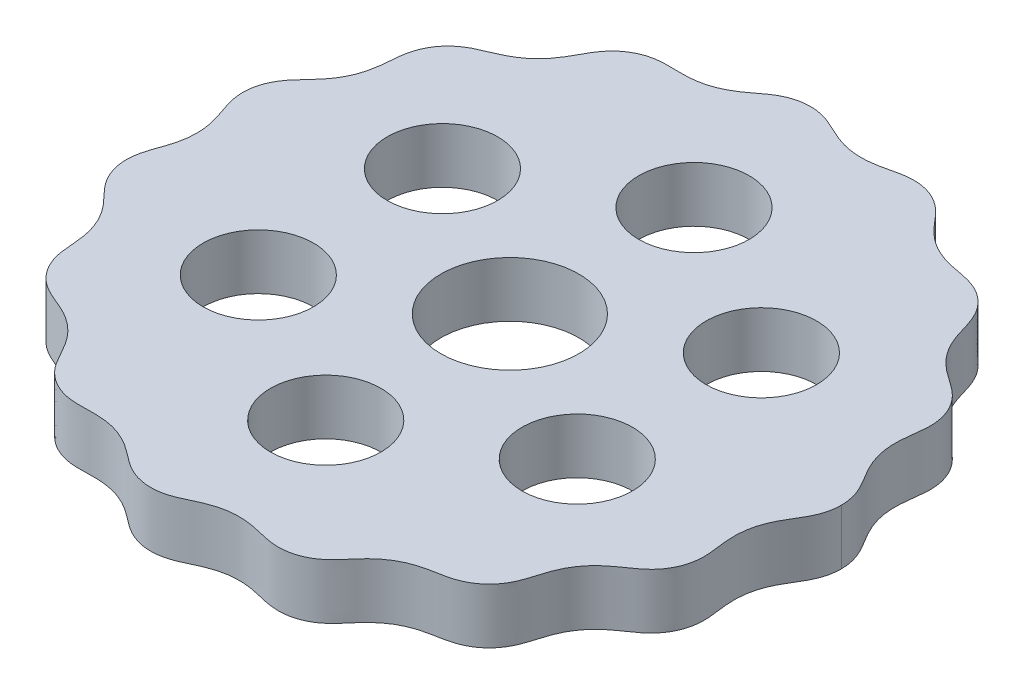
from build123d import *

# Parameters (mm, degrees)
BOSS_EXTRUDE1_DEPTH = 6
SKETCH4_R           = 7.5
SKETCH4_R_2         = 6
CUT_EXTRUDE1_DEPTH  = 52.384193919


with BuildPart() as part:
    # Sketch3 → Boss-Extrude1 (new body)
    with BuildSketch(Plane(origin=(0, 0, 0), x_dir=(1, 0, 0), z_dir=(0, 1, 0))):
        with BuildLine():
            add(Edge.make_bspline(
                [(-35, 0), (-35, -0.035819522), (-35.000616373, -0.107462841), (-35.003390054, -0.256808001), (-35.01077535, -0.421646413), (-35.021825769, -0.588219856), (-35.036504882, -0.756672424), (-35.059341773, -0.965837166), (-35.104035951, -1.290553755), (-35.185204177, -1.728353622), (-35.321111932, -2.274340703), (-35.511398877, -2.882930915), (-35.744117036, -3.541888991), (-35.999231193, -4.25800942), (-36.256031973, -5.161379022), (-36.390330129, -6.274752326), (-36.277015947, -7.512136969), (-35.868698722, -8.695231313), (-35.277300884, -9.669426211), (-34.554347705, -10.519941998), (-33.783626013, -11.298902855), (-32.985846748, -12.201646947), (-32.264584631, -13.30297659), (-31.737724515, -14.528623762), (-31.426244596, -15.845428611), (-31.299137645, -17.27258243), (-31.216127, -18.70530298), (-30.816120234, -20.100603953), (-30.073240875, -21.341751418), (-29.174351138, -22.250438515), (-28.172415899, -22.896093055), (-27.127590318, -23.355931746), (-26.10859664, -23.758738206), (-25.049780962, -24.277964858), (-23.989709649, -24.997868072), (-23.038745697, -25.922173331), (-22.234852767, -27.03288543), (-21.57001817, -28.281907032), (-20.900127092, -29.513378936), (-19.962466181, -30.574068753), (-18.795181919, -31.366318649), (-17.595631263, -31.810691732), (-16.414666993, -31.974330851), (-15.281171148, -31.958959306), (-14.203514384, -31.91747762), (-13.042151806, -31.968001953), (-11.783279681, -32.201214224), (-10.531309832, -32.66971044), (-9.48395263, -33.292502605), (-8.648334169, -33.920550223), (-7.823957174, -34.560196788), (-6.963270269, -35.155080008), (-5.844676613, -35.655024643), (-4.471519425, -35.893755086), (-3.187084678, -35.805499477), (-2.025952576, -35.461710054), (-0.992256939, -34.976213141), (-0.022683462, -34.502923006), (1.053080375, -34.087641485), (2.299584809, -33.794526859), (3.643320491, -33.722351619), (5.038534255, -33.89893647), (6.24598376, -34.2125404), (7.264354515, -34.444119372), (8.305207807, -34.543324073), (9.35208771, -34.482213909), (10.516758731, -34.167289325), (11.659268337, -33.537177777), (12.590715473, -32.709121516), (13.34098787, -31.814858509), (14.054283468, -30.982389039), (14.885038409, -30.182951686), (15.921872801, -29.431794231), (16.990420846, -28.917750141), (18.026343297, -28.602305782), (18.918007091, -28.413618025), (19.578784746, -28.293993849), (20.403759493, -28.135463838), (21.377672688, -27.861653344), (22.443971731, -27.335099919), (23.483734656, -26.460176512), (24.2541157, -25.405895772), (24.750574375, -24.262578026), (25.063904971, -23.146552345), (25.378639074, -22.114017621), (25.813131886, -21.064921211), (26.460434486, -19.960662125), (27.343829971, -18.932625358), (28.322904319, -18.143559056), (29.218225657, -17.541804862), (30.028748291, -16.97273782), (30.797058719, -16.328598531), (31.549909645, -15.413617977), (32.137977425, -14.188738612), (32.4089126, -12.90202686), (32.388985538, -11.637704019), (32.213594686, -10.474436855), (32.085323796, -9.385180269), (32.070146733, -8.410557002), (32.151917663, -7.56387468), (32.314560623, -6.756019588), (32.548800101, -5.992599911), (32.857935391, -5.266485518), (33.224571124, -4.579437291), (33.588738685, -3.973485748), (33.923596212, -3.433268023), (34.247631958, -2.87530324), (34.535248612, -2.28660009), (34.721954293, -1.781365153), (34.833464319, -1.375289499), (34.894669525, -1.087159539), (34.924762046, -0.921603412), (34.949915122, -0.755248907), (34.967564963, -0.608302523), (34.979558938, -0.483828007), (34.987456793, -0.380154151), (34.992514334, -0.294893351), (34.997257891, -0.183172559), (34.999367206, -0.089514524), (35, -0.035799586), (35, 0)],
                knots=[0.072369566, 0.072369566, 0.072369566, 0.072369566, 0.072369566, 0.073615092, 0.074860618, 0.076106145, 0.077351671, 0.078597197, 0.079842723, 0.082333775, 0.087048504, 0.091763233, 0.096477961, 0.10119269, 0.107724794, 0.114256899, 0.124215283, 0.134174364, 0.144132897, 0.150929746, 0.157726596, 0.167142542, 0.176558488, 0.186520945, 0.196481925, 0.206428247, 0.21637457, 0.228908069, 0.238866866, 0.248825964, 0.258784129, 0.266347185, 0.273910241, 0.282559119, 0.291207998, 0.301173216, 0.311644672, 0.321600071, 0.33155547, 0.343058906, 0.353017844, 0.362977018, 0.372934936, 0.380512964, 0.388090993, 0.396475019, 0.404859045, 0.41482336, 0.425823506, 0.435780105, 0.440758404, 0.445736704, 0.456709828, 0.4666684, 0.476627191, 0.48658549, 0.494428383, 0.502271277, 0.510390705, 0.518510134, 0.528474739, 0.540002591, 0.549960093, 0.559917595, 0.565389224, 0.570860853, 0.580819423, 0.590778216, 0.600736338, 0.609094586, 0.617452834, 0.625307542, 0.633162249, 0.643125841, 0.655188139, 0.660154677, 0.665121215, 0.670087753, 0.675054292, 0.685012018, 0.694970449, 0.704929277, 0.714887192, 0.723259667, 0.731632143, 0.739222078, 0.746812013, 0.756777196, 0.769365725, 0.779035556, 0.783870472, 0.788705388, 0.798661668, 0.808620831, 0.818580086, 0.828537566, 0.837174689, 0.845811813, 0.853388632, 0.860965452, 0.865947313, 0.870929173, 0.87773944, 0.884549706, 0.889251298, 0.893952891, 0.898654484, 0.903356076, 0.908334949, 0.913313821, 0.914558654, 0.915803487, 0.91704832, 0.918293153, 0.919537985, 0.920160402, 0.920782818, 0.921405235, 0.922027651, 0.923272484, 0.923272484, 0.923272484, 0.923272484, 0.923272484], degree=4))
            add(Edge.make_bspline(
                [(-35, 0), (-35, 0.035819522), (-35.000616373, 0.107462841), (-35.003390054, 0.256808001), (-35.01077535, 0.421646413), (-35.021825769, 0.588219856), (-35.036504882, 0.756672424), (-35.059341773, 0.965837166), (-35.104035951, 1.290553755), (-35.185204177, 1.728353622), (-35.321111932, 2.274340703), (-35.511398877, 2.882930915), (-35.744117036, 3.541888991), (-35.999231193, 4.25800942), (-36.256031973, 5.161379022), (-36.390330129, 6.274752326), (-36.277015947, 7.512136969), (-35.868698722, 8.695231313), (-35.277300884, 9.669426211), (-34.554347705, 10.519941998), (-33.783626013, 11.298902855), (-32.985846748, 12.201646947), (-32.264584631, 13.30297659), (-31.737724515, 14.528623762), (-31.426244596, 15.845428611), (-31.299137645, 17.27258243), (-31.216127, 18.70530298), (-30.816120234, 20.100603953), (-30.073240875, 21.341751418), (-29.174351138, 22.250438515), (-28.172415899, 22.896093055), (-27.127590318, 23.355931746), (-26.10859664, 23.758738206), (-25.049780962, 24.277964858), (-23.989709649, 24.997868072), (-23.038745697, 25.922173331), (-22.234852767, 27.03288543), (-21.57001817, 28.281907032), (-20.900127092, 29.513378936), (-19.962466181, 30.574068753), (-18.795181919, 31.366318649), (-17.595631263, 31.810691732), (-16.414666993, 31.974330851), (-15.281171148, 31.958959306), (-14.203514384, 31.91747762), (-13.042151806, 31.968001953), (-11.783279681, 32.201214224), (-10.531309831, 32.66971044), (-9.48395263, 33.292502605), (-8.648334169, 33.920550223), (-7.823957174, 34.560196788), (-6.963270269, 35.155080008), (-5.844676613, 35.655024643), (-4.471519425, 35.893755086), (-3.187084678, 35.805499476), (-2.025952576, 35.461710054), (-0.992256939, 34.976213141), (-0.022683462, 34.502923006), (1.053080375, 34.087641485), (2.299584809, 33.794526859), (3.643320491, 33.722351618), (5.038534255, 33.89893647), (6.24598376, 34.2125404), (7.264354515, 34.444119372), (8.305207807, 34.543324073), (9.35208771, 34.482213909), (10.516758731, 34.167289325), (11.659268337, 33.537177777), (12.590715473, 32.709121516), (13.34098787, 31.814858509), (14.054283468, 30.982389039), (14.885038409, 30.182951686), (15.921872801, 29.431794231), (16.990420846, 28.917750141), (18.026343297, 28.602305782), (18.918007091, 28.413618025), (19.578784746, 28.293993848), (20.403759493, 28.135463838), (21.377672688, 27.861653344), (22.443971731, 27.335099919), (23.483734656, 26.460176512), (24.2541157, 25.405895772), (24.750574375, 24.262578026), (25.063904971, 23.146552345), (25.378639074, 22.114017621), (25.813131886, 21.064921211), (26.460434486, 19.960662125), (27.343829971, 18.932625358), (28.322904319, 18.143559056), (29.218225657, 17.541804862), (30.028748291, 16.97273782), (30.797058719, 16.328598531), (31.549909645, 15.413617977), (32.137977425, 14.188738612), (32.4089126, 12.90202686), (32.388985538, 11.637704019), (32.213594686, 10.474436855), (32.085323796, 9.385180269), (32.070146733, 8.410557002), (32.151917663, 7.56387468), (32.314560623, 6.756019588), (32.548800101, 5.992599911), (32.857935391, 5.266485518), (33.224571124, 4.579437291), (33.588738685, 3.973485748), (33.923596212, 3.433268023), (34.247631958, 2.87530324), (34.535248612, 2.28660009), (34.721954293, 1.781365153), (34.833464319, 1.375289499), (34.894669525, 1.087159539), (34.924762046, 0.921603411), (34.949915122, 0.755248907), (34.967564963, 0.608302523), (34.979558938, 0.483828007), (34.987456793, 0.380154151), (34.992514334, 0.294893351), (34.997257891, 0.183172559), (34.999367206, 0.089514524), (35, 0.035799586), (35, 0)],
                knots=[0.072369566, 0.072369566, 0.072369566, 0.072369566, 0.072369566, 0.073615092, 0.074860618, 0.076106145, 0.077351671, 0.078597197, 0.079842723, 0.082333775, 0.087048504, 0.091763233, 0.096477961, 0.10119269, 0.107724794, 0.114256899, 0.124215283, 0.134174364, 0.144132897, 0.150929746, 0.157726596, 0.167142542, 0.176558488, 0.186520945, 0.196481925, 0.206428247, 0.21637457, 0.228908069, 0.238866866, 0.248825964, 0.258784129, 0.266347185, 0.273910241, 0.282559119, 0.291207998, 0.301173216, 0.311644672, 0.321600071, 0.33155547, 0.343058906, 0.353017844, 0.362977018, 0.372934936, 0.380512964, 0.388090993, 0.396475019, 0.404859045, 0.41482336, 0.425823506, 0.435780105, 0.440758404, 0.445736704, 0.456709828, 0.4666684, 0.476627191, 0.48658549, 0.494428383, 0.502271277, 0.510390705, 0.518510134, 0.528474739, 0.540002591, 0.549960093, 0.559917595, 0.565389224, 0.570860853, 0.580819423, 0.590778216, 0.600736338, 0.609094586, 0.617452834, 0.625307542, 0.633162249, 0.643125841, 0.655188139, 0.660154677, 0.665121215, 0.670087753, 0.675054292, 0.685012018, 0.694970449, 0.704929277, 0.714887192, 0.723259667, 0.731632143, 0.739222078, 0.746812013, 0.756777196, 0.769365725, 0.779035556, 0.783870472, 0.788705388, 0.798661668, 0.808620831, 0.818580086, 0.828537566, 0.837174689, 0.845811813, 0.853388632, 0.860965452, 0.865947313, 0.870929173, 0.87773944, 0.884549706, 0.889251298, 0.893952891, 0.898654484, 0.903356076, 0.908334949, 0.913313821, 0.914558654, 0.915803487, 0.91704832, 0.918293153, 0.919537985, 0.920160402, 0.920782818, 0.921405235, 0.922027651, 0.923272484, 0.923272484, 0.923272484, 0.923272484, 0.923272484], degree=4))
        make_face()
    extrude(amount=BOSS_EXTRUDE1_DEPTH)

    # Sketch4 → Cut-Extrude1 (cut, through all)
    with BuildSketch(Plane(origin=(0, 6, 0), x_dir=(1, 0, 0), z_dir=(0, 1, 0))):
        with Locations((-1, 0)):
            Circle(SKETCH4_R)
        with Locations((-1, 20)):
            Circle(SKETCH4_R_2)
        with Locations((16.320508076, 10)):
            Circle(SKETCH4_R_2)
        with Locations((16.320508076, -10)):
            Circle(SKETCH4_R_2)
        with Locations((-1, -20)):
            Circle(SKETCH4_R_2)
        with Locations((-18.320508076, -10)):
            Circle(SKETCH4_R_2)
        with Locations((-18.320508076, 10)):
            Circle(SKETCH4_R_2)
    extrude(amount=-CUT_EXTRUDE1_DEPTH, mode=Mode.SUBTRACT)


solid = part.part
